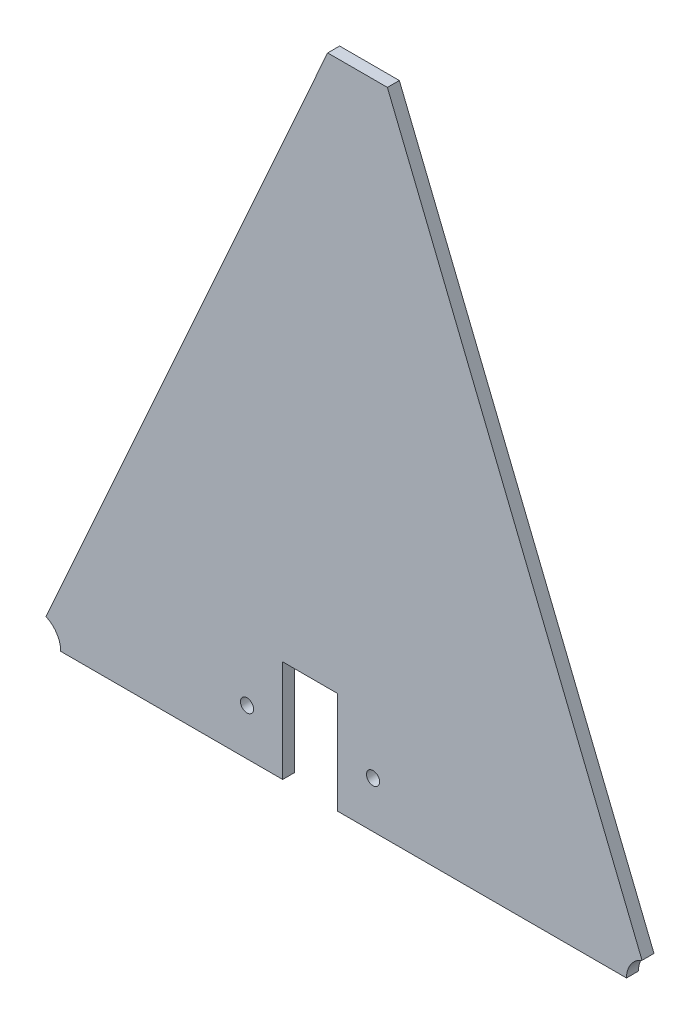
from build123d import *

# Parameters (mm, degrees)
BOSS_EXTRUDE1_DEPTH     = 7.62
SKETCH5_R               = 15.875
CUT_EXTRUDE2_DEPTH      = 50.8
SKETCH6_R               = 15.875
CUT_EXTRUDE3_DEPTH      = 50.8
CUT_EXTRUDE4_DEPTH      = 444.557362906
CUT_EXTRUDE4_DEPTH_BACK = 7.62
CUT_EXTRUDE6_REACH      = 445.557
SKETCH9_R               = 4.191


with BuildPart() as part:
    # Sketch2 → Boss-Extrude1 (new body)
    with BuildSketch(Plane.XY):
        Polygon((-189.740054039, 245.383385713), (-375.90852523, -170.414614287), (16.77547477, -170.414614287), (-151.640054039, 245.383385713), align=None)
    extrude(amount=BOSS_EXTRUDE1_DEPTH)

    # Sketch5 → Cut-Extrude2 (cut)
    with BuildSketch(Plane(origin=(0, 0, 0), x_dir=(-1, 0, 0), z_dir=(0, 0, -1))):
        with Locations((375.90852523, -170.414614287)):
            Circle(SKETCH5_R)
    extrude(amount=-CUT_EXTRUDE2_DEPTH, mode=Mode.SUBTRACT)

    # Sketch6 → Cut-Extrude3 (cut)
    with BuildSketch(Plane(origin=(0, 0, 0), x_dir=(-1, 0, 0), z_dir=(0, 0, -1))):
        with Locations((-16.77547477, -170.414614287)):
            Circle(SKETCH6_R)
    extrude(amount=-CUT_EXTRUDE3_DEPTH, mode=Mode.SUBTRACT)

    # Sketch8 → Cut-Extrude4 (cut, two sides: drawn at the far end of the back side and taken through both)
    with BuildSketch(Plane(origin=(0, 0, 0), x_dir=(-1, 0, 0), z_dir=(0, 0, -1)).offset(-CUT_EXTRUDE4_DEPTH_BACK)):
        Polygon((218.448947474, -1130.046710402), (218.448947474, -170.414614287), (218.448947474, -105.390614287), (183.523947474, -105.390614287), (183.523947474, -170.414614287), (183.523947474, -1130.046710402), (183.523947474, -3049.310902633), (218.448947474, -3049.310902633), align=None)
    extrude(amount=CUT_EXTRUDE4_DEPTH + CUT_EXTRUDE4_DEPTH_BACK, mode=Mode.SUBTRACT)

    # Sketch9 → Cut-Extrude6 (cut, up to next)
    with BuildSketch(Plane(origin=(0, 0, 0), x_dir=(-1, 0, 0), z_dir=(0, 0, -1)), mode=Mode.PRIVATE) as cut_extrude6_sk1:
        with Locations((160.790947474, -140.823614287)):
            Circle(SKETCH9_R)
    cut_extrude6_tool1 = extrude(cut_extrude6_sk1.sketch, amount=-CUT_EXTRUDE6_REACH, mode=Mode.PRIVATE) & part.part
    # Sketch9 → Cut-Extrude6 (cut, up to next)
    with BuildSketch(Plane(origin=(0, 0, 0), x_dir=(-1, 0, 0), z_dir=(0, 0, -1)), mode=Mode.PRIVATE) as cut_extrude6_sk2:
        with Locations((241.181947474, -140.823614287)):
            Circle(SKETCH9_R)
    cut_extrude6_tool2 = extrude(cut_extrude6_sk2.sketch, amount=-CUT_EXTRUDE6_REACH, mode=Mode.PRIVATE) & part.part
    add(cut_extrude6_tool1.solids().sort_by_distance((-160.790947, -140.823614, 0))[0], mode=Mode.SUBTRACT)
    add(cut_extrude6_tool2.solids().sort_by_distance((-241.181947, -140.823614, 0))[0], mode=Mode.SUBTRACT)


solid = part.part
